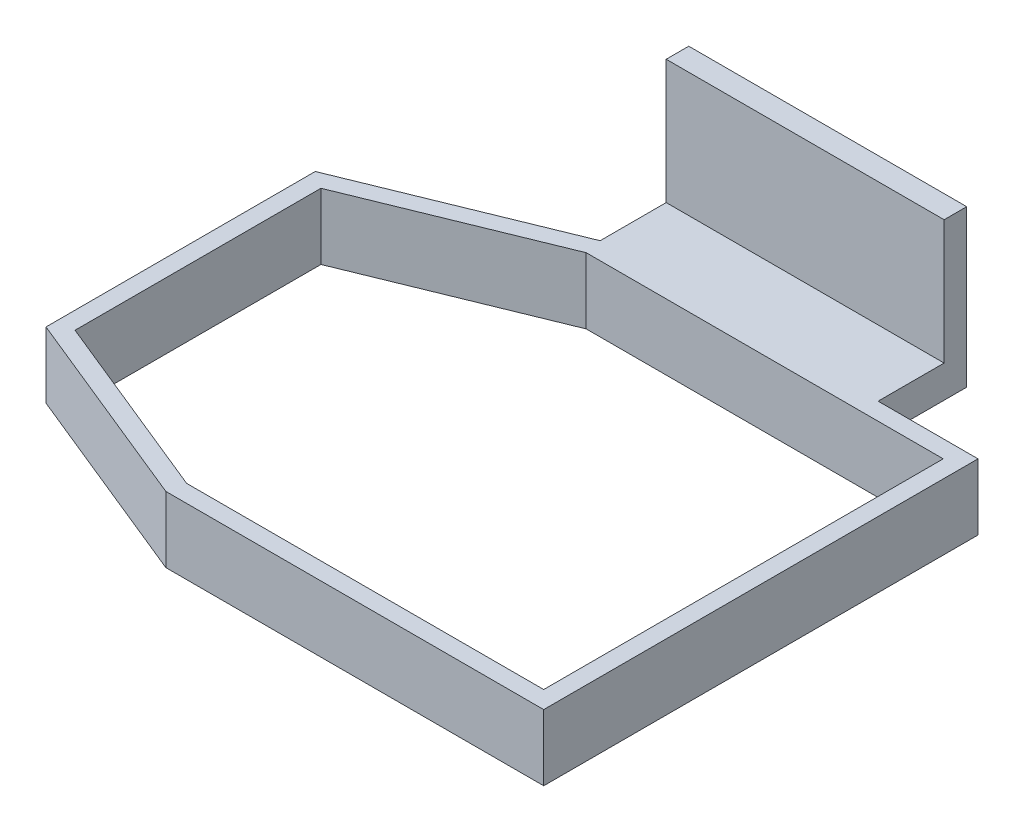
from build123d import *

# Parameters (mm, degrees)
SKETCH_1_W      = 32
SKETCH_1_H      = 18
EXTRUDE_1_DEPTH = 2.6
SKETCH_2_W      = 32
SKETCH_2_H      = 3.708656252
EXTRUDE_2_DEPTH = 7.6
EXTRUDE_3_DEPTH = 7.6


with BuildPart() as part:
    # 草图1 → 凸台-拉伸1 (new body)
    with BuildSketch(Plane.XY):
        Rectangle(SKETCH_1_W, SKETCH_1_H)
    extrude(amount=EXTRUDE_1_DEPTH)

    # 草图2 → 凸台-拉伸2 (add)
    with BuildSketch(Plane.XY.offset(2.6)):
        with Locations((0, -7.145671874)):
            Rectangle(SKETCH_2_W, SKETCH_2_H)
    extrude(amount=EXTRUDE_2_DEPTH)

    # 草图3 → 凸台-拉伸3 (add)
    with BuildSketch(Plane(origin=(0, -5.291343748, 0), x_dir=(1, 0, 0), z_dir=(0, 1, 0))):
        Polygon((27.5, -10.2), (-16, -10.2), (-39.3, -19.7), (-39.3, -50.7), (-16, -60.2), (27.5, -60.2), align=None)
        Polygon((25.5, -12.2), (-15.607942453, -12.2), (-37.3, -21.044401146), (-37.3, -49.355598854), (-15.607942453, -58.2), (25.5, -58.2), align=None, mode=Mode.SUBTRACT)
    extrude(amount=-EXTRUDE_3_DEPTH)


solid = part.part
